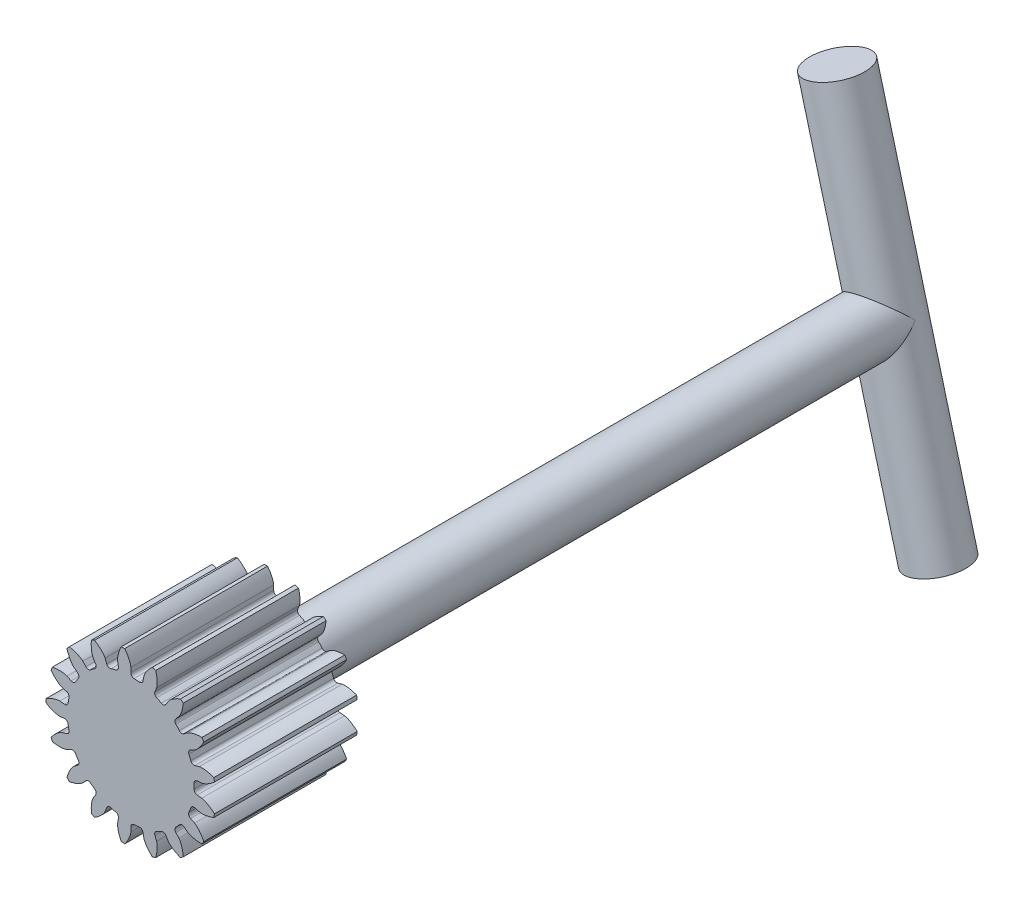
from build123d import *

# Parameters (mm, degrees)
BLANK_SKETCH_R           = 11.875
BLANK_DEPTH              = 20
TOOTH_SPACE_DEPTH        = 27.11572802
TEETH_COUNT              = 17
BORE_DEPTH               = 27.102125703
BORE_DEPTH_BACK          = 27.102125703
BORE_SKETCH_R            = 4
BOSS_EXTRUDE1_START      = -106
SKETCH1_R                = 4
BOSS_EXTRUDE1_DEPTH      = 106
BOSS_EXTRUDE2_DEPTH      = 27.5
BOSS_EXTRUDE2_DEPTH_BACK = 27.5
SKETCH2_R                = 4


with BuildPart() as part:
    # Blank Sketch → Blank (new body)
    with BuildSketch(Plane.XY):
        Circle(BLANK_SKETCH_R)
    extrude(amount=BLANK_DEPTH)

    # Tooth Space Sketch → Tooth Space (cut, symmetric)
    with BuildSketch(Plane.XY):
        with BuildLine():
            Line((9.942364801, 0.91340716), (9.298767719, 0.854279759))
            ThreePointArc((9.298767719, 0.854279759), (8.984863997, 0.694192597), (8.867618155, 0.361902274))
            ThreePointArc((8.867618155, 0.361902274), (8.875, 0), (8.867618155, -0.361902274))
            ThreePointArc((8.867618155, -0.361902274), (8.984863997, -0.694192597), (9.298767719, -0.854279759))
            Line((9.298767719, -0.854279759), (9.942364801, -0.91340716))
            add(Edge.make_bspline(
                [(9.942364801, -0.91340716), (9.947707774, -0.913995463), (9.962658326, -0.915943937), (9.990773403, -0.92080477), (10.03637124, -0.930398576), (10.094010888, -0.945054989), (10.167889919, -0.966771469), (10.254035794, -0.995895766), (10.347670082, -1.031581288), (10.448308522, -1.074335805), (10.547535018, -1.120434221), (10.645345427, -1.169591339), (10.74167088, -1.221399901), (10.856958299, -1.28747082), (10.993207383, -1.371281114), (11.149344102, -1.475798759), (11.322581132, -1.601986981), (11.494732709, -1.73857283), (11.660412139, -1.879471881), (11.823262512, -2.029086969), (11.977584919, -2.17897923), (12.132897457, -2.341825663), (12.273746711, -2.495808162), (12.42574568, -2.675962445), (12.546739308, -2.823606943), (12.666700658, -2.982295404), (12.724336253, -3.060430467), (12.753472124, -3.10073762)],
                knots=[0, 0, 0, 0, 0, 0.005376748, 0.015083688, 0.02853182, 0.046610139, 0.064854849, 0.092110525, 0.119476176, 0.146842495, 0.174208854, 0.201574955, 0.228941013, 0.256307345, 0.307035032, 0.361767351, 0.41649966, 0.471231936, 0.525964282, 0.580696615, 0.635428982, 0.690161387, 0.744893688, 0.799626082, 0.854358408, 0.909090915, 0.909090915, 0.909090915, 0.909090915, 0.909090915], degree=4))
            Line((12.753472124, -3.10073762), (12.753472124, 3.10073762))
            add(Edge.make_bspline(
                [(9.942364801, 0.91340716), (9.947707774, 0.913995463), (9.962658326, 0.915943937), (9.990773403, 0.92080477), (10.03637124, 0.930398576), (10.094010888, 0.945054989), (10.167889919, 0.966771469), (10.254035794, 0.995895766), (10.347670082, 1.031581288), (10.448308522, 1.074335805), (10.547535018, 1.120434221), (10.645345427, 1.169591339), (10.74167088, 1.221399901), (10.856958299, 1.28747082), (10.993207383, 1.371281114), (11.149344102, 1.475798759), (11.322581132, 1.601986981), (11.494732709, 1.73857283), (11.660412139, 1.879471881), (11.823262512, 2.029086969), (11.977584919, 2.17897923), (12.132897457, 2.341825663), (12.273746711, 2.495808162), (12.42574568, 2.675962445), (12.546739308, 2.823606943), (12.666700658, 2.982295404), (12.724336253, 3.060430467), (12.753472124, 3.10073762)],
                knots=[0, 0, 0, 0, 0, 0.005376748, 0.015083688, 0.02853182, 0.046610139, 0.064854849, 0.092110525, 0.119476176, 0.146842495, 0.174208854, 0.201574955, 0.228941013, 0.256307345, 0.307035032, 0.361767351, 0.41649966, 0.471231936, 0.525964282, 0.580696615, 0.635428982, 0.690161387, 0.744893688, 0.799626082, 0.854358408, 0.909090915, 0.909090915, 0.909090915, 0.909090915, 0.909090915], degree=4))
        make_face()
    tooth_space = extrude(amount=TOOTH_SPACE_DEPTH, both=True, mode=Mode.SUBTRACT)

    # Teeth: Tooth Space ×17 about axis
    teeth_axis = Axis((0, 0, -95.500007), (0, 0, 1))
    for i in range(1, TEETH_COUNT):
        add(tooth_space.rotate(teeth_axis, i * 360 / TEETH_COUNT), mode=Mode.SUBTRACT)

    # Bore Sketch → Bore (cut, two sides: drawn at the far end of the back side and taken through both)
    with BuildSketch(Plane.XY.offset(-BORE_DEPTH_BACK)):
        Circle(BORE_SKETCH_R)
    extrude(amount=BORE_DEPTH + BORE_DEPTH_BACK, mode=Mode.SUBTRACT)

    # Sketch1 → Boss-Extrude1 (add)
    with BuildSketch(Plane.XY.offset(20).offset(BOSS_EXTRUDE1_START)):
        Circle(SKETCH1_R)
    extrude(amount=BOSS_EXTRUDE1_DEPTH)

    # Sketch2 → Boss-Extrude2 (add, two sides: drawn at the far end of the back side and taken through both)
    with BuildSketch(Plane(origin=(0, 0, 0), x_dir=(0, 0, -1), z_dir=(-0.25761039233351624, 0.9662488736147493, 0)).offset(-BOSS_EXTRUDE2_DEPTH_BACK)):
        with Locations((86, 0)):
            Circle(SKETCH2_R)
    extrude(amount=BOSS_EXTRUDE2_DEPTH + BOSS_EXTRUDE2_DEPTH_BACK)


solid = part.part
